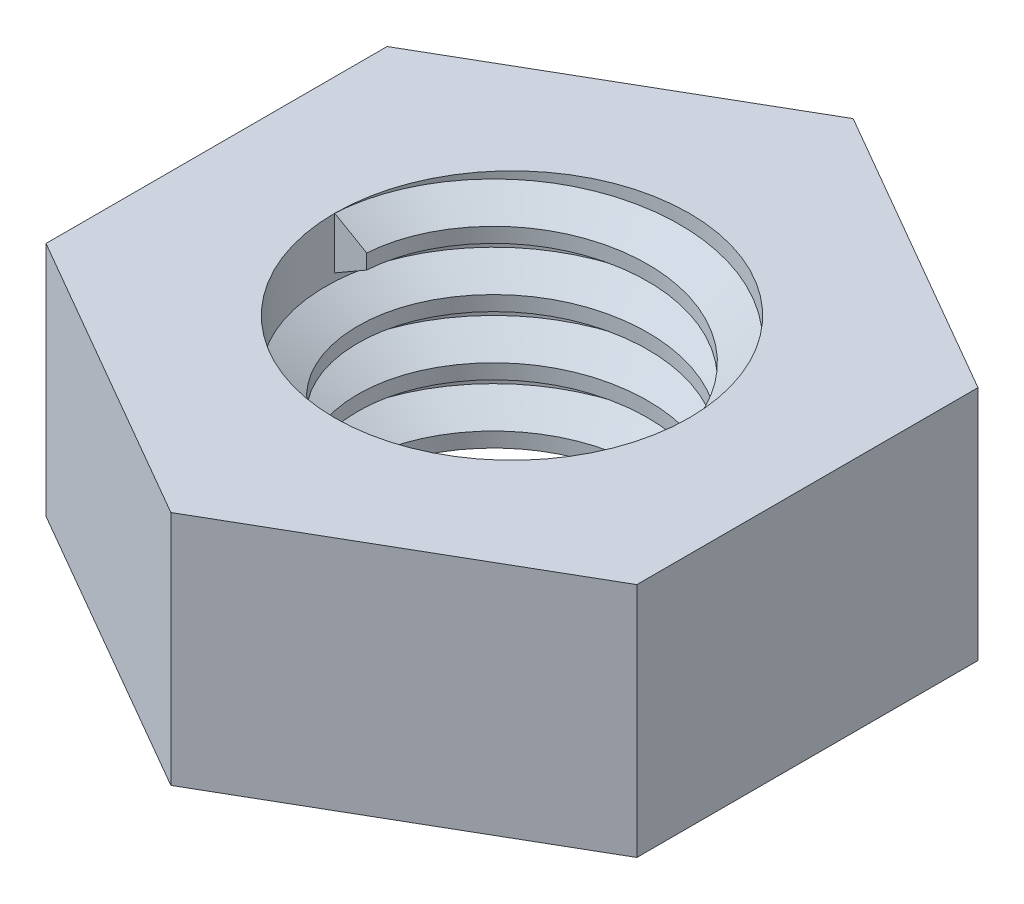
from build123d import *
from build123d.topology import SkipClean

# Parameters (mm, degrees)
BOSS_EXTRUDE1_DEPTH = 6.35
SKETCH2_R           = 4.7625
CUT_EXTRUDE1_DEPTH  = 14.68691399
THREAD1_PITCH       = 1.5875


with BuildPart() as part:
    # Sketch1 → Boss-Extrude1 (new body)
    with BuildSketch(Plane(origin=(0, 0, 0), x_dir=(1, 0, 0), z_dir=(0, 1, 0))):
        Polygon((7.9375, -4.582717762), (7.9375, 4.582717762), (0, 9.165435523), (-7.9375, 4.582717762), (-7.9375, -4.582717762), (0, -9.165435523), align=None)
    extrude(amount=BOSS_EXTRUDE1_DEPTH)

    # Sketch2 → Cut-Extrude1 (cut, through all)
    with BuildSketch(Plane(origin=(0, 6.35, 0), x_dir=(1, 0, 0), z_dir=(0, 1, 0))):
        with Locations(Location((0, 0, 0), (0, 0, 270))):
            Circle(SKETCH2_R)
    extrude(amount=-CUT_EXTRUDE1_DEPTH, mode=Mode.SUBTRACT)

    # Thread1: the profile of Thread Profile1 profile screwed along a right-hand helix of 4 turns, 8 arcs to a turn; built about Z, then put on its axis
    with SkipClean():  # the faces are left unmerged after this step: merging them gives an invalid solid
        thread1_z = Axis((0, 0, 0), (0, 0, 1))
        thread1_corners = [(4.7628, 0, -0.000173205), (4.7628, 0, 1.389235701), (3.903240423, 0, 0.892968748), (3.903240423, 0, 0.496093748)]
        with BuildLine(mode=Mode.PRIVATE) as thread1_profile:
            Line(thread1_corners[0], thread1_corners[1])
            Line(thread1_corners[1], thread1_corners[2])
            Line(thread1_corners[2], thread1_corners[3])
            Line(thread1_corners[3], thread1_corners[0])
        thread1_cap = Face(thread1_profile.wire())
        thread1_turn_angles = [0, 22.5, 45, 67.5, 90, 112.5, 135, 157.5, 180, 202.5, 225, 247.5, 270, 292.5, 315, 337.5, 360]
        thread1_turn_weights = [1, 0.9238795325112867, 1, 0.9238795325112867, 1, 0.9238795325112867, 1, 0.9238795325112867, 1, 0.9238795325112867, 1, 0.9238795325112867, 1, 0.9238795325112867, 1, 0.9238795325112867, 1]
        thread1_turn_rails = [Edge.make_bspline([Vector(p[0], p[1], 0).rotate(thread1_z, thread1_turn_angles[k]) / thread1_turn_weights[k] + Vector(0, 0, p[2] + THREAD1_PITCH * thread1_turn_angles[k] / 360) for k in range(17)], [0, 0, 0, 1, 1, 2, 2, 3, 3, 4, 4, 5, 5, 6, 6, 7, 7, 8, 8, 8], 2, thread1_turn_weights) for p in thread1_corners]
        thread1_turn_sides = [Face.make_surface_from_curves(thread1_turn_rails[p[0]], thread1_turn_rails[p[1]]) for p in [(0, 1), (1, 2), (2, 3), (3, 0)]]
        thread1 = Plane(origin=(0, 6.35, 0), x_dir=(-1, 0, 0), z_dir=(0, -1, 0)) * Solid(Shell([*[p.moved(Location((0, 0, THREAD1_PITCH * i))) for i in range(4) for p in thread1_turn_sides], thread1_cap, thread1_cap.rotate(thread1_z, 1440).moved(Location((0, 0, THREAD1_PITCH * 1440 / 360)))]))
        add(thread1)


solid = part.part
